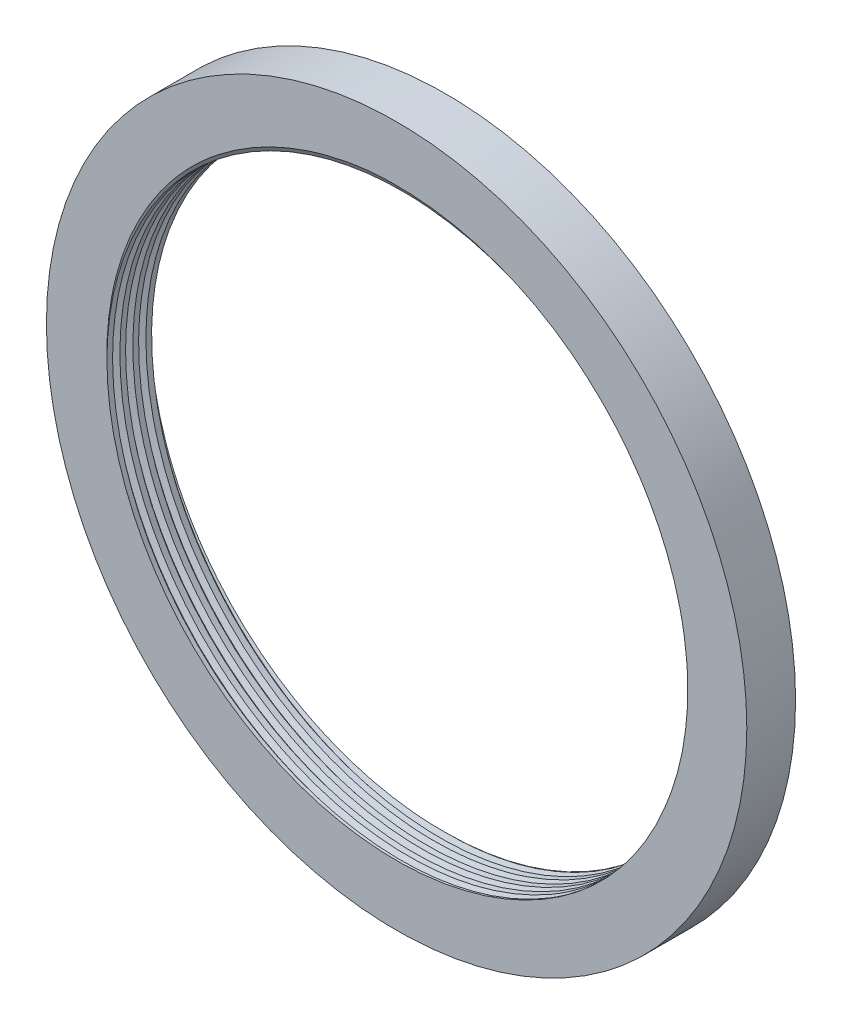
from build123d import *

# Parameters (mm, degrees)
SKETCH1_R           = 53.85
SKETCH1_R_2         = 44.55
BOSS_EXTRUDE1_DEPTH = 7.5
THREAD1_PITCH       = 2


with BuildPart() as part:
    # Sketch1 → Boss-Extrude1 (new body)
    with BuildSketch(Plane.XY):
        Circle(SKETCH1_R)
        Circle(SKETCH1_R_2, mode=Mode.SUBTRACT)
    extrude(amount=BOSS_EXTRUDE1_DEPTH)

    # Thread1: arcs per turn and ends read off the stored shape
    # Thread1: the profile of Thread Profile1 profile screwed along a right-hand helix through 5 turns, 10 arcs to a turn; built about Z, then put on its axis
    thread1_z = Axis((0, 0, 0), (0, 0, 1))
    thread1_corners = [(44.5497, 0, -10.000173205), (45.361898812, 0, -9.531250002), (45.361898812, 0, -9.343750002), (44.5497, 0, -8.874826799)]
    with BuildLine(mode=Mode.PRIVATE) as thread1_profile:
        Line(thread1_corners[0], thread1_corners[1])
        Line(thread1_corners[1], thread1_corners[2])
        Line(thread1_corners[2], thread1_corners[3])
        Line(thread1_corners[3], thread1_corners[0])
    thread1_cap = Face(thread1_profile.wire())
    thread1_turn_angles = [0, 18, 36, 54, 72, 90, 108, 126, 144, 162, 180, 198, 216, 234, 252, 270, 288, 306, 324, 342, 360]
    thread1_turn_weights = [1, 0.9510565162951535, 1, 0.9510565162951535, 1, 0.9510565162951535, 1, 0.9510565162951535, 1, 0.9510565162951535, 1, 0.9510565162951535, 1, 0.9510565162951535, 1, 0.9510565162951535, 1, 0.9510565162951535, 1, 0.9510565162951535, 1]
    thread1_turn_rails = [Edge.make_bspline([Vector(p[0], p[1], 0).rotate(thread1_z, thread1_turn_angles[k]) / thread1_turn_weights[k] + Vector(0, 0, p[2] + THREAD1_PITCH * thread1_turn_angles[k] / 360) for k in range(21)], [0, 0, 0, 1, 1, 2, 2, 3, 3, 4, 4, 5, 5, 6, 6, 7, 7, 8, 8, 9, 9, 10, 10, 10], 2, thread1_turn_weights) for p in thread1_corners]
    thread1_turn_sides = [Face.make_surface_from_curves(thread1_turn_rails[p[0]], thread1_turn_rails[p[1]]) for p in [(0, 1), (1, 2), (2, 3), (3, 0)]]
    thread1 = Plane(origin=(0, 0, 7.5), x_dir=(-1, 0, 0), z_dir=(0, 0, 1)) * Solid(Shell([*[p.moved(Location((0, 0, THREAD1_PITCH * i))) for i in range(5) for p in thread1_turn_sides], thread1_cap, thread1_cap.rotate(thread1_z, 1800).moved(Location((0, 0, THREAD1_PITCH * 1800 / 360)))]))
    add(thread1, mode=Mode.SUBTRACT)


solid = part.part
